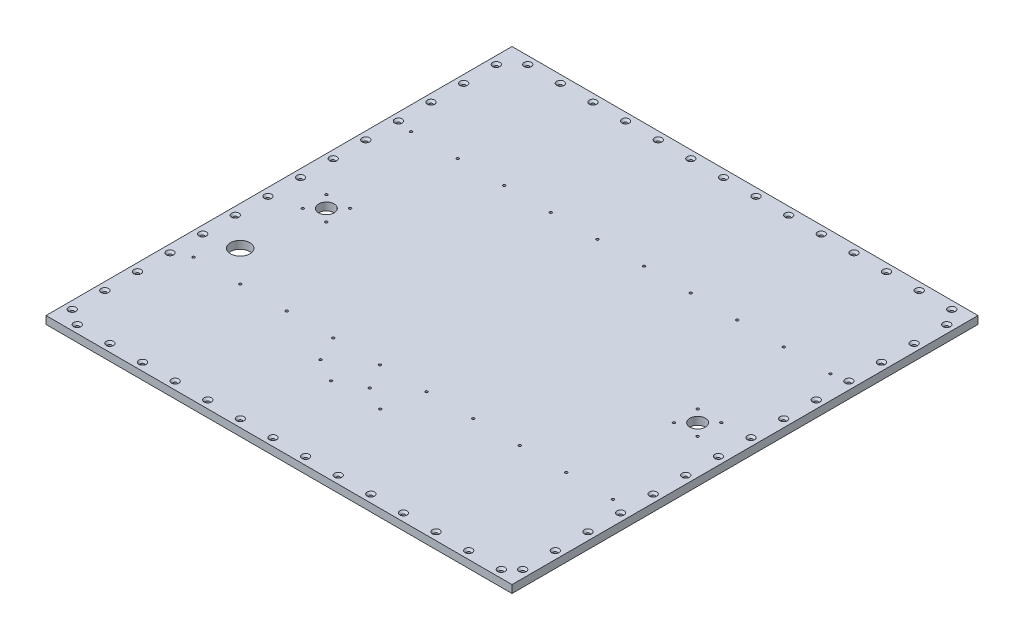
from build123d import *

# Parameters (mm, degrees)
SKETCH1_W                                       = 600
SKETCH1_H                                       = 600
BOSS_EXTRUDE1_DEPTH                             = 10
CSK_FOR_M4_FLAT_HEAD_MACHINE_SCREW1_D           = 4.3
CSK_FOR_M4_FLAT_HEAD_MACHINE_SCREW1_CSINK_D     = 9.4
CSK_FOR_M4_FLAT_HEAD_MACHINE_SCREW1_CSINK_ANGLE = 90
CSK_FOR_M3_FLAT_HEAD_MACHINE_SCREW1_D           = 3.2
CSK_FOR_M3_FLAT_HEAD_MACHINE_SCREW1_CSINK_D     = 6.3
CSK_FOR_M3_FLAT_HEAD_MACHINE_SCREW1_CSINK_ANGLE = 90
SKETCH7_R                                       = 10
CUT_EXTRUDE1_DEPTH                              = 10
CSK_FOR_M3_FLAT_HEAD_MACHINE_SCREW2_D           = 3.2
CSK_FOR_M3_FLAT_HEAD_MACHINE_SCREW2_CSINK_D     = 6.3
CSK_FOR_M3_FLAT_HEAD_MACHINE_SCREW2_CSINK_ANGLE = 90
CSK_FOR_M3_FLAT_HEAD_MACHINE_SCREW3_D           = 3.2
CSK_FOR_M3_FLAT_HEAD_MACHINE_SCREW3_CSINK_D     = 6.3
CSK_FOR_M3_FLAT_HEAD_MACHINE_SCREW3_CSINK_ANGLE = 90
CSK_FOR_M3_FLAT_HEAD_MACHINE_SCREW4_D           = 3.2
CSK_FOR_M3_FLAT_HEAD_MACHINE_SCREW4_DEPTH       = 6
CSK_FOR_M3_FLAT_HEAD_MACHINE_SCREW4_CSINK_D     = 6.3
CSK_FOR_M3_FLAT_HEAD_MACHINE_SCREW4_CSINK_ANGLE = 90
CSK_FOR_M3_FLAT_HEAD_MACHINE_SCREW4_TIP         = 0.96137699
SKETCH14_R                                      = 4
CUT_EXTRUDE2_DEPTH                              = 5
SKETCH15_R                                      = 4
CUT_EXTRUDE3_DEPTH                              = 5
SKETCH16_R                                      = 12.5
CUT_EXTRUDE4_DEPTH                              = 10
F_3_0MM_DOWEL_HOLE1_D                           = 3.2


with BuildPart() as part:
    # Sketch1 → Boss-Extrude1 (new body)
    with BuildSketch(Plane(origin=(0, 0, 0), x_dir=(1, 0, 0), z_dir=(0, 1, 0))):
        with Locations((300, 300)):
            Rectangle(SKETCH1_W, SKETCH1_H)
    extrude(amount=BOSS_EXTRUDE1_DEPTH)

    # CSK for M4 Flat Head Machine Screw1 (through all)
    with Locations(Plane(origin=(0, 10, 0), x_dir=(1, 0, 0), z_dir=(0, 1, 0))):
        with Locations((10, 569.75), (30.25, 590), (72.25, 590), (114.25, 590), (156.25, 590), (198.25, 590), (240.25, 590), (282.25, 590), (324.25, 590), (366.25, 590), (408.25, 590), (450.25, 590), (492.25, 590), (534.25, 590), (576.25, 590), (72.25, 10), (114.25, 10), (156.25, 10), (198.25, 10), (240.25, 10), (282.25, 10), (324.25, 10), (366.25, 10), (408.25, 10), (450.25, 10), (492.25, 10), (534.25, 10), (576.25, 10), (30.25, 10), (590, 569.75), (590, 527.75), (590, 485.75), (590, 443.75), (590, 401.75), (590, 359.75), (590, 317.75), (590, 275.75), (590, 233.75), (590, 191.75), (590, 149.75), (590, 107.75), (590, 65.75), (590, 23.75), (10, 527.75), (10, 485.75), (10, 443.75), (10, 401.75), (10, 359.75), (10, 317.75), (10, 275.75), (10, 233.75), (10, 191.75), (10, 149.75), (10, 107.75), (10, 65.75), (10, 23.75)):
            CounterSinkHole(CSK_FOR_M4_FLAT_HEAD_MACHINE_SCREW1_D / 2, CSK_FOR_M4_FLAT_HEAD_MACHINE_SCREW1_CSINK_D / 2, counter_sink_angle=CSK_FOR_M4_FLAT_HEAD_MACHINE_SCREW1_CSINK_ANGLE)

    # CSK for M3 Flat Head Machine Screw1 (through all)
    with Locations(Plane(origin=(0, 0, 0), x_dir=(-1, 0, 0), z_dir=(0, -1, 0))):
        with Locations((-570, 160), (-570, 440), (-510, 160), (-510, 440), (-450, 160), (-450, 440), (-390, 160), (-390, 440), (-330, 160), (-330, 440), (-270, 160), (-270, 440), (-210, 160), (-210, 440), (-150, 160), (-150, 440), (-90, 160), (-90, 440), (-30, 160), (-30, 440)):
            CounterSinkHole(CSK_FOR_M3_FLAT_HEAD_MACHINE_SCREW1_D / 2, CSK_FOR_M3_FLAT_HEAD_MACHINE_SCREW1_CSINK_D / 2, counter_sink_angle=CSK_FOR_M3_FLAT_HEAD_MACHINE_SCREW1_CSINK_ANGLE)

    # Sketch7 → Cut-Extrude1 (cut)
    with BuildSketch(Plane(origin=(0, 0, 0), x_dir=(-1, 0, 0), z_dir=(0, -1, 0))):
        with Locations((-61, 300)):
            Circle(SKETCH7_R)
        with Locations((-539, 300)):
            Circle(SKETCH7_R)
    extrude(amount=-CUT_EXTRUDE1_DEPTH, mode=Mode.SUBTRACT)

    # CSK for M3 Flat Head Machine Screw2 (through all)
    with Locations(Plane(origin=(0, 0, 0), x_dir=(-1, 0, 0), z_dir=(0, -1, 0))):
        with Locations((-45.75, 315.25), (-76.25, 315.25), (-76.25, 284.75), (-45.75, 284.75)):
            CounterSinkHole(CSK_FOR_M3_FLAT_HEAD_MACHINE_SCREW2_D / 2, CSK_FOR_M3_FLAT_HEAD_MACHINE_SCREW2_CSINK_D / 2, counter_sink_angle=CSK_FOR_M3_FLAT_HEAD_MACHINE_SCREW2_CSINK_ANGLE)

    # CSK for M3 Flat Head Machine Screw3 (through all)
    with Locations(Plane(origin=(0, 0, 0), x_dir=(-1, 0, 0), z_dir=(0, -1, 0))):
        with Locations((-523.75, 315.25), (-554.25, 315.25), (-554.25, 284.75), (-523.75, 284.75)):
            CounterSinkHole(CSK_FOR_M3_FLAT_HEAD_MACHINE_SCREW3_D / 2, CSK_FOR_M3_FLAT_HEAD_MACHINE_SCREW3_CSINK_D / 2, counter_sink_angle=CSK_FOR_M3_FLAT_HEAD_MACHINE_SCREW3_CSINK_ANGLE)

    # CSK for M3 Flat Head Machine Screw4
    with Locations(Plane(origin=(0, 0, 0), x_dir=(-1, 0, 0), z_dir=(0, -1, 0))):
        with Locations((-549.5, 118.5), (-549.5, 68.8), (-397.5, 118.5), (-397.5, 68.8)):
            CounterSinkHole(CSK_FOR_M3_FLAT_HEAD_MACHINE_SCREW4_D / 2, CSK_FOR_M3_FLAT_HEAD_MACHINE_SCREW4_CSINK_D / 2, depth=CSK_FOR_M3_FLAT_HEAD_MACHINE_SCREW4_DEPTH, counter_sink_angle=CSK_FOR_M3_FLAT_HEAD_MACHINE_SCREW4_CSINK_ANGLE)
            with Locations((0, 0, -(CSK_FOR_M3_FLAT_HEAD_MACHINE_SCREW4_DEPTH + CSK_FOR_M3_FLAT_HEAD_MACHINE_SCREW4_TIP / 2))):  # 118° drill point
                Cone(0, CSK_FOR_M3_FLAT_HEAD_MACHINE_SCREW4_D / 2, CSK_FOR_M3_FLAT_HEAD_MACHINE_SCREW4_TIP, mode=Mode.SUBTRACT)

    # Sketch14 → Cut-Extrude2 (cut)
    with BuildSketch(Plane.XZ):
        with Locations((425, -42)):
            Circle(SKETCH14_R)
    extrude(amount=-CUT_EXTRUDE2_DEPTH, mode=Mode.SUBTRACT)

    # Sketch15 → Cut-Extrude3 (cut)
    with BuildSketch(Plane(origin=(0, 0, 0), x_dir=(-1, 0, 0), z_dir=(0, -1, 0))):
        with Locations((-175, 42)):
            Circle(SKETCH15_R)
    extrude(amount=-CUT_EXTRUDE3_DEPTH, mode=Mode.SUBTRACT)

    # Sketch16 → Cut-Extrude4 (cut)
    with BuildSketch(Plane(origin=(0, 10, 0), x_dir=(1, 0, 0), z_dir=(0, 1, 0))):
        with Locations((50, 200)):
            Circle(SKETCH16_R)
    extrude(amount=-CUT_EXTRUDE4_DEPTH, mode=Mode.SUBTRACT)

    # Ø3.0mm Dowel Hole1 (through all)
    with Locations(Plane(origin=(0, 10, 0), x_dir=(1, 0, 0), z_dir=(0, 1, 0))):
        with Locations((319.5, 110.75), (289.25, 127.5), (256.25, 110.75), (226, 127.5)):
            Hole(F_3_0MM_DOWEL_HOLE1_D / 2)


solid = part.part
